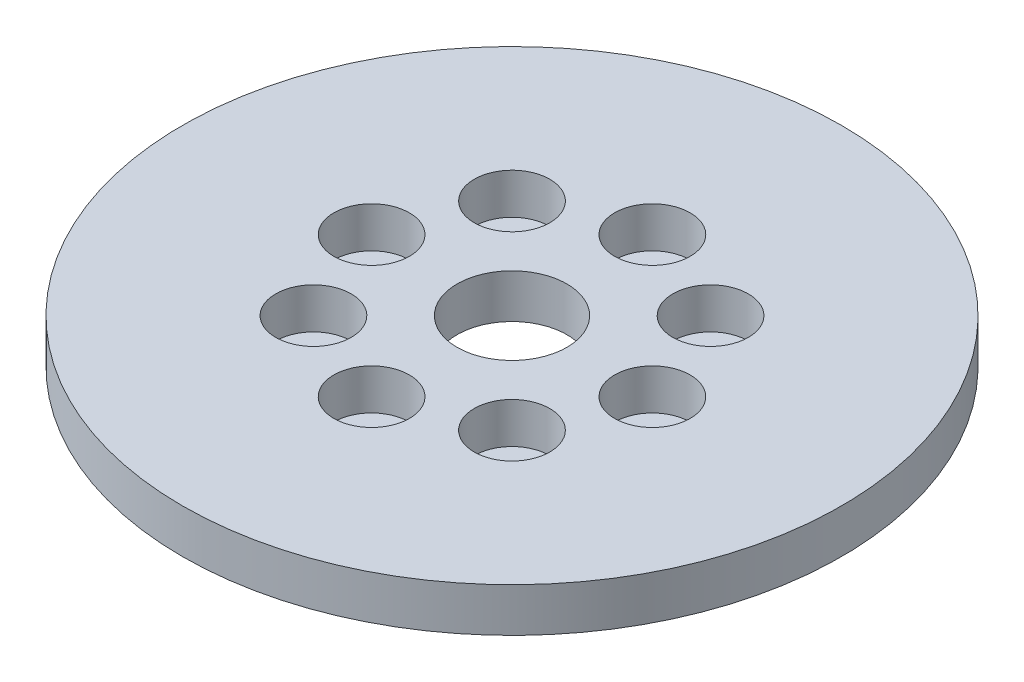
from build123d import *

# Parameters (mm, degrees)
SKETCH1_R           = 45
BOSS_EXTRUDE1_DEPTH = 6
SKETCH2_R           = 7.5
CUT_EXTRUDE1_DEPTH  = 64.921827258
SKETCH3_R           = 5.155562803
CUT_EXTRUDE2_DEPTH  = 5.569826726
CIRPATTERN1_COUNT   = 8


with BuildPart() as part:
    # Sketch1 → Boss-Extrude1 (new body)
    with BuildSketch(Plane(origin=(0, 0, 0), x_dir=(1, 0, 0), z_dir=(0, 1, 0))):
        Circle(SKETCH1_R)
    extrude(amount=BOSS_EXTRUDE1_DEPTH)

    # Sketch2 → Cut-Extrude1 (cut, through all)
    with BuildSketch(Plane(origin=(0, 0, 0), x_dir=(1, 0, 0), z_dir=(0, 1, 0))):
        Circle(SKETCH2_R)
    extrude(amount=CUT_EXTRUDE1_DEPTH, mode=Mode.SUBTRACT)

    # Sketch3 → Cut-Extrude2 (cut)
    with BuildSketch(Plane(origin=(0, 6, 0), x_dir=(1, 0, 0), z_dir=(0, 1, 0))):
        with Locations((-19.170152002, 0)):
            Circle(SKETCH3_R)
    cut_extrude2 = extrude(amount=-CUT_EXTRUDE2_DEPTH, mode=Mode.SUBTRACT)

    # CirPattern1: Cut-Extrude2 ×8 about axis
    cirpattern1_axis = Axis((0, 0, 0), (0, 1, 0))
    for i in range(1, CIRPATTERN1_COUNT):
        add(cut_extrude2.rotate(cirpattern1_axis, i * 360 / CIRPATTERN1_COUNT), mode=Mode.SUBTRACT)


solid = part.part
